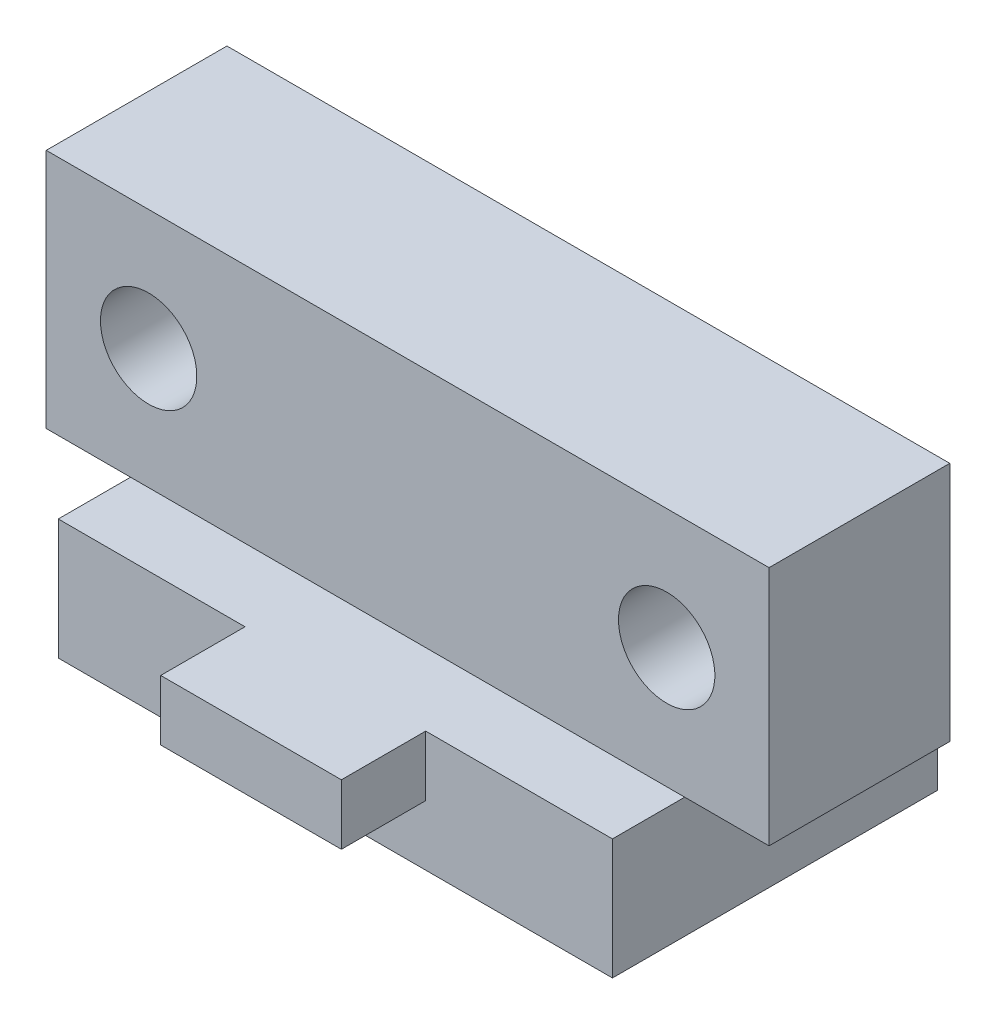
from build123d import *

# Parameters (mm, degrees)
SKETCH1_W           = 46
SKETCH1_H           = 27
BOSS_EXTRUDE1_DEPTH = 10
SKETCH2_W           = 60
SKETCH2_H           = 15
BOSS_EXTRUDE2_DEPTH = 20
SKETCH3_R           = 4
CUT_EXTRUDE2_DEPTH  = 65.420493634
SKETCH6_W           = 15
SKETCH6_H           = 5
BOSS_EXTRUDE4_DEPTH = 7


with BuildPart() as part:
    # Sketch1 → Boss-Extrude1 (new body)
    with BuildSketch(Plane(origin=(0, 0, 0), x_dir=(1, 0, 0), z_dir=(0, 1, 0))):
        with Locations((23, 13.5)):
            Rectangle(SKETCH1_W, SKETCH1_H)
    extrude(amount=BOSS_EXTRUDE1_DEPTH)

    # Sketch2 → Boss-Extrude2 (add)
    with BuildSketch(Plane(origin=(0, 10, 0), x_dir=(1, 0, 0), z_dir=(0, 1, 0))):
        with Locations((23, 13.5)):
            Rectangle(SKETCH2_W, SKETCH2_H)
    extrude(amount=BOSS_EXTRUDE2_DEPTH)

    # Sketch3 → Cut-Extrude2 (cut, through all)
    with BuildSketch(Plane(origin=(0, 0, -21), x_dir=(-1, 0, 0), z_dir=(0, 0, -1))):
        with Locations((-44.5, 20)):
            Circle(SKETCH3_R)
        with Locations((-1.5, 20)):
            Circle(SKETCH3_R)
    extrude(amount=-CUT_EXTRUDE2_DEPTH, mode=Mode.SUBTRACT)

    # Sketch6 → Boss-Extrude4 (add)
    with BuildSketch(Plane.XY):
        with Locations((23, 7.5)):
            Rectangle(SKETCH6_W, SKETCH6_H)
    extrude(amount=BOSS_EXTRUDE4_DEPTH)


solid = part.part
